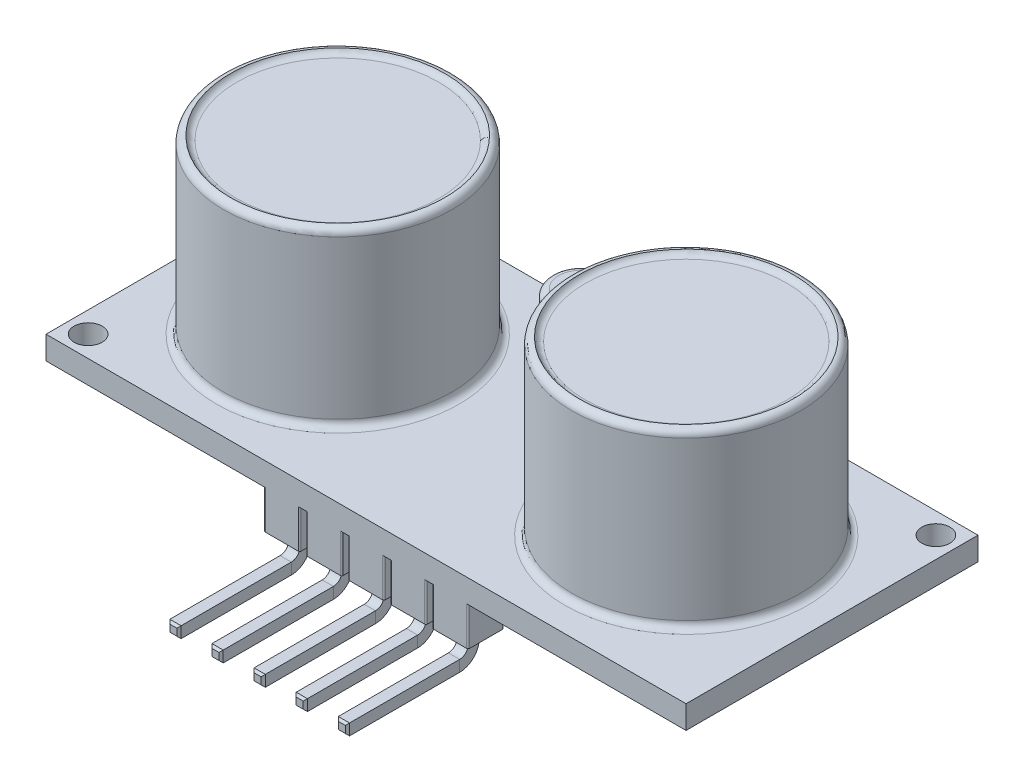
from build123d import *

# Parameters (mm, degrees)
SKETCH1_W                  = 45.6
SKETCH1_H                  = 20.8
BOSS_EXTRUDE1_DEPTH        = 1.65
BOSS_EXTRUDE2_DEPTH        = 3.35
FILLET1_R                  = 0.5
SKETCH4_R                  = 8.15
BOSS_EXTRUDE3_DEPTH        = 12.25
FILLET2_R                  = 0.5
SKETCH6_R                  = 7.65
CUT_EXTRUDE1_DEPTH         = 0.3
FILLET3_R                  = 0.5
SKETCH7_R                  = 1
CUT_EXTRUDE2_DEPTH         = 28.893771706
SKETCH9_W                  = 0.8
SKETCH9_H                  = 0.8
CHAMFER1_SIZE              = 0.15
LPATTERN3_COUNT            = 3
LPATTERN3_PITCH            = 3
CHAMFER1_OF_LPATTERN3_SIZE = 0.15
LPATTERN4_COUNT            = 3
LPATTERN4_PITCH            = 3
CHAMFER1_OF_LPATTERN4_SIZE = 0.15
SKETCH10_W                 = 2.55
SKETCH10_H                 = 2.55
BOSS_EXTRUDE4_DEPTH        = 2.75
FILLET4_R                  = 0.1
LPATTERN5_COUNT            = 5
LPATTERN5_PITCH            = 3
FILLET4_OF_LPATTERN5_R     = 0.1


with BuildPart() as part:
    # Sketch1 → Boss-Extrude1 (new body)
    with BuildSketch(Plane(origin=(0, 0, 0), x_dir=(1, 0, 0), z_dir=(0, 1, 0))):
        Rectangle(SKETCH1_W, SKETCH1_H)
    extrude(amount=BOSS_EXTRUDE1_DEPTH)

    # Sketch2 → Boss-Extrude2 (add)
    with BuildSketch(Plane(origin=(0, 1.65, 0), x_dir=(1, 0, 0), z_dir=(0, 1, 0))):
        with BuildLine():
            Line((-3.175, 10.25), (3.175, 10.25))
            ThreePointArc((3.175, 10.25), (5.3, 8.125), (3.175, 6))
            Line((3.175, 6), (-3.175, 6))
            ThreePointArc((-3.175, 6), (-5.3, 8.125), (-3.175, 10.25))
        make_face()
    extrude(amount=BOSS_EXTRUDE2_DEPTH)

    # Fillet1
    fillet1_edges = [part.edges().sort_by_distance(p)[0] for p in [
        (-5.3, 5, -8.125),
        (0, 5, -6),
        (5.3, 5, -8.125),
        (0, 5, -10.25),
    ]]
    fillet(fillet1_edges, radius=FILLET1_R)

    # Sketch4 → Boss-Extrude3 (add)
    with BuildSketch(Plane(origin=(0, 1.65, 0), x_dir=(1, 0, 0), z_dir=(0, 1, 0))):
        with Locations(Location((12.415962636, 0, 0), (0, 0, 90))):
            Circle(SKETCH4_R)
        with Locations(Location((-12.415962636, 0, 0), (0, 0, 90))):
            Circle(SKETCH4_R)
    extrude(amount=BOSS_EXTRUDE3_DEPTH)

    # Fillet2
    fillet2_edges = [part.edges().sort_by_distance(p)[0] for p in [
        (12.415962636, 1.65, 8.15),
        (12.415962636, 13.9, 8.15),
        (-12.415962636, 1.65, 8.15),
        (-12.415962636, 13.9, 8.15),
    ]]
    fillet(fillet2_edges, radius=FILLET2_R)

    # Sketch6 → Cut-Extrude1 (cut)
    with BuildSketch(Plane(origin=(0, 13.9, 0), x_dir=(1, 0, 0), z_dir=(0, 1, 0))):
        with Locations(Location((12.415962636, 0, 0), (0, 0, 270))):
            Circle(SKETCH6_R)
        with Locations(Location((-12.415962636, 0, 0), (0, 0, 270))):
            Circle(SKETCH6_R)
    extrude(amount=-CUT_EXTRUDE1_DEPTH, mode=Mode.SUBTRACT)

    # Fillet3
    # the kernel refuses this fillet: 0.5 mm, written as the material it adds along each edge
    with BuildSketch(Plane(origin=(12.415962636, 13.6, 0), x_dir=(0, 0, 1), z_dir=(-1, 0, 0))) as fillet3_piece_1:
        with BuildLine():
            CenterArc((7.191742431, 0.5), FILLET3_R, 270, 66.421821522)
            Line((7.191742431, 0), (7.191742431, -0.01))
            Line((7.191742431, -0.01), (7.65, -0.01))
            Line((7.65, -0.01), (7.66, 0))
            ThreePointArc((7.66, 0), (7.66, 0.15), (7.659165151, 0.296))
            Line((7.659165151, 0.296), (7.65, 0.3))
        make_face()
    revolve(axis=Axis((12.415962636, 13.6, 0), (0, 1, 0)), revolution_arc=179.999999776)
    with BuildSketch(Plane(origin=(12.415962636, 13.6, 0), x_dir=(3.90111484147698e-09, 0, -1.0), z_dir=(1.0, 0, 3.90111484147698e-09))) as fillet3_piece_2:
        with BuildLine():
            CenterArc((7.191742431, 0.5), FILLET3_R, 270, 66.421821522)
            Line((7.191742431, 0), (7.191742431, -0.01))
            Line((7.191742431, -0.01), (7.65, -0.01))
            Line((7.65, -0.01), (7.66, 0))
            ThreePointArc((7.66, 0), (7.66, 0.15), (7.659165151, 0.296))
            Line((7.659165151, 0.296), (7.65, 0.3))
        make_face()
    revolve(axis=Axis((12.415962636, 13.6, 0), (0, 1, 0)), revolution_arc=180.000000224)
    with BuildSketch(Plane(origin=(-12.415962636, 13.6, 0), x_dir=(0, 0, 1), z_dir=(-1, 0, 0))) as fillet3_piece_3:
        with BuildLine():
            CenterArc((7.191742431, 0.5), FILLET3_R, 270, 66.421821522)
            Line((7.191742431, 0), (7.191742431, -0.01))
            Line((7.191742431, -0.01), (7.65, -0.01))
            Line((7.65, -0.01), (7.66, 0))
            ThreePointArc((7.66, 0), (7.66, 0.15), (7.659165151, 0.296))
            Line((7.659165151, 0.296), (7.65, 0.3))
        make_face()
    revolve(axis=Axis((-12.415962636, 13.6, 0), (0, 1, 0)), revolution_arc=179.999999776)
    with BuildSketch(Plane(origin=(-12.415962636, 13.6, 0), x_dir=(3.901114841476977e-09, 0, -1.0), z_dir=(1.0, 0, 3.901114841476977e-09))) as fillet3_piece_4:
        with BuildLine():
            CenterArc((7.191742431, 0.5), FILLET3_R, 270, 66.421821522)
            Line((7.191742431, 0), (7.191742431, -0.01))
            Line((7.191742431, -0.01), (7.65, -0.01))
            Line((7.65, -0.01), (7.66, 0))
            ThreePointArc((7.66, 0), (7.66, 0.15), (7.659165151, 0.296))
            Line((7.659165151, 0.296), (7.65, 0.3))
        make_face()
    revolve(axis=Axis((-12.415962636, 13.6, 0), (0, 1, 0)), revolution_arc=180.000000224)

    # Sketch7 → Cut-Extrude2 (cut, through all)
    with BuildSketch(Plane(origin=(0, 1.65, 0), x_dir=(1, 0, 0), z_dir=(0, 1, 0))):
        with Locations(Location((-21.3, -8.9, 0), (0, 0, 270))):
            Circle(SKETCH7_R)
        with Locations(Location((21.3, 8.9, 0), (0, 0, 270))):
            Circle(SKETCH7_R)
    extrude(amount=-CUT_EXTRUDE2_DEPTH, mode=Mode.SUBTRACT)

    # Sweep1: sweep along a path in Sketch8
    with BuildLine(Plane(origin=(0, 0, 0), x_dir=(0, 0, -1), z_dir=(1, 0, 0))) as sweep1_path:
        Line((-9.125, 0), (-9.125, -3.35))
        ThreePointArc((-9.125, -3.35), (-9.417893219, -4.057106781), (-10.125, -4.35))
        Line((-10.125, -4.35), (-18.125, -4.35))
    # Sketch9 → Sweep1 (sweep)
    with BuildSketch(Plane.XZ):
        with Locations((0, 9.125)):
            Rectangle(SKETCH9_W, SKETCH9_H)
    sweep1 = sweep(path=sweep1_path.line)

    # Chamfer1
    chamfer1_edges = [part.edges().sort_by_distance(p)[0] for p in [
        (-0.4, -4.35, 18.125),
        (0, -4.75, 18.125),
        (0.4, -4.35, 18.125),
        (0, -3.95, 18.125),
    ]]
    chamfer(chamfer1_edges, length=CHAMFER1_SIZE)

    # LPattern3: Sweep1 ×3
    with Locations(*[(-i * LPATTERN3_PITCH, 0, 0) for i in range(1, LPATTERN3_COUNT)]):
        add(sweep1)

    # Chamfer1 of LPattern3
    chamfer1_of_lpattern3_edges = [part.edges().sort_by_distance(p)[0] for p in [
        (-3.4, -4.35, 18.125),
        (-3, -4.75, 18.125),
        (-2.6, -4.35, 18.125),
        (-3, -3.95, 18.125),
        (-6.4, -4.35, 18.125),
        (-6, -4.75, 18.125),
        (-5.6, -4.35, 18.125),
        (-6, -3.95, 18.125),
    ]]
    chamfer(chamfer1_of_lpattern3_edges, length=CHAMFER1_OF_LPATTERN3_SIZE)

    # LPattern4: Sweep1 ×3
    with Locations(*[(i * LPATTERN4_PITCH, 0, 0) for i in range(1, LPATTERN4_COUNT)]):
        add(sweep1)

    # Chamfer1 of LPattern4
    chamfer1_of_lpattern4_edges = [part.edges().sort_by_distance(p)[0] for p in [
        (2.6, -4.35, 18.125),
        (3, -4.75, 18.125),
        (3.4, -4.35, 18.125),
        (3, -3.95, 18.125),
        (5.6, -4.35, 18.125),
        (6, -4.75, 18.125),
        (6.4, -4.35, 18.125),
        (6, -3.95, 18.125),
    ]]
    chamfer(chamfer1_of_lpattern4_edges, length=CHAMFER1_OF_LPATTERN4_SIZE)

    # Sketch10 → Boss-Extrude4 (add)
    with BuildSketch(Plane.XZ):
        with Locations((-6, 9.125)):
            Rectangle(SKETCH10_W, SKETCH10_H)
    boss_extrude4 = extrude(amount=BOSS_EXTRUDE4_DEPTH)

    # Fillet4
    fillet4_edges = [part.edges().sort_by_distance(p)[0] for p in [
        (-7.275, -1.375, 10.4),
        (-7.275, -1.375, 7.85),
        (-4.725, -1.375, 7.85),
        (-4.725, -1.375, 10.4),
    ]]
    fillet(fillet4_edges, radius=FILLET4_R)

    # LPattern5: Boss-Extrude4 ×5
    with Locations(*[(i * LPATTERN5_PITCH, 0, 0) for i in range(1, LPATTERN5_COUNT)]):
        add(boss_extrude4)

    # Fillet4 of LPattern5
    fillet4_of_lpattern5_edges = [part.edges().sort_by_distance(p)[0] for p in [
        (-4.275, -1.375, 10.4),
        (-4.275, -1.375, 7.85),
        (-1.725, -1.375, 7.85),
        (-1.725, -1.375, 10.4),
        (-1.275, -1.375, 10.4),
        (-1.275, -1.375, 7.85),
        (1.275, -1.375, 7.85),
        (1.275, -1.375, 10.4),
        (1.725, -1.375, 10.4),
        (1.725, -1.375, 7.85),
        (4.275, -1.375, 7.85),
        (4.275, -1.375, 10.4),
        (4.725, -1.375, 10.4),
        (4.725, -1.375, 7.85),
        (7.275, -1.375, 7.85),
        (7.275, -1.375, 10.4),
    ]]
    fillet(fillet4_of_lpattern5_edges, radius=FILLET4_OF_LPATTERN5_R)


solid = part.part
